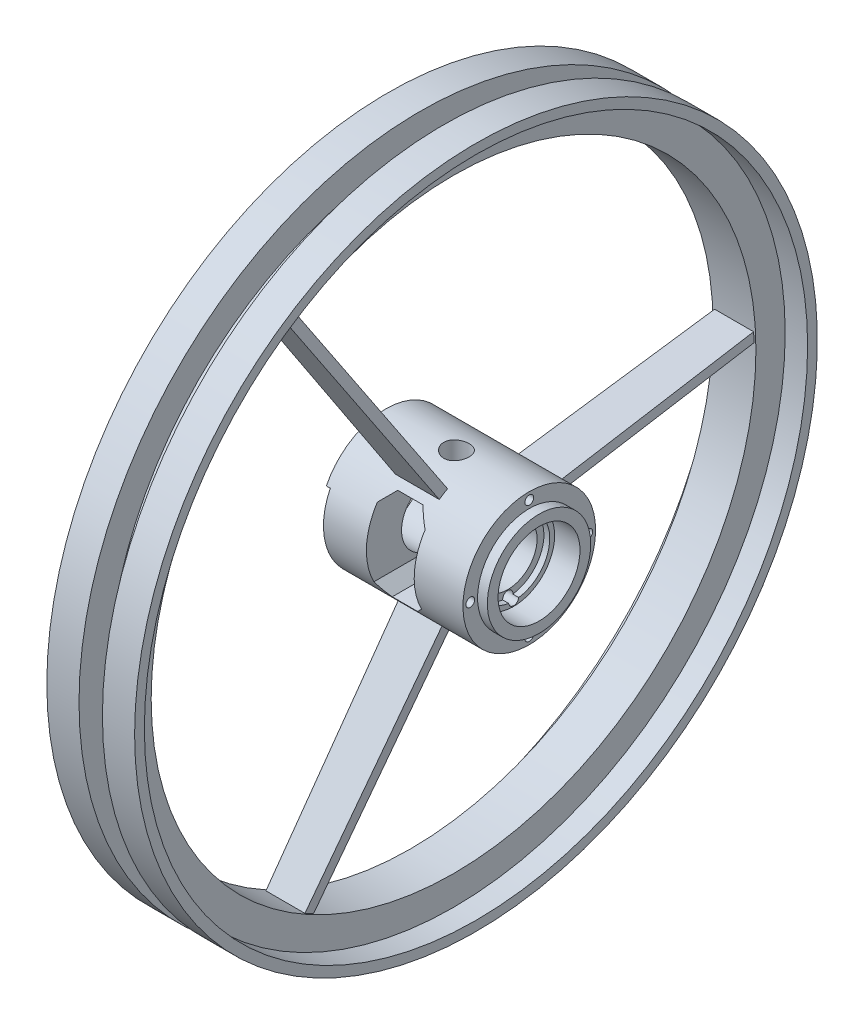
from build123d import *

# Parameters (mm, degrees)
SKETCH1_R                          = 68
BOSS_EXTRUDE1_DEPTH                = 157
CUT_EXTRUDE1_REACH                 = 186.111
SKETCH2_R                          = 26
SKETCH3_W                          = 136
SKETCH3_H                          = 98
CUT_EXTRUDE2_DEPTH                 = 4
CUT_EXTRUDE3_DEPTH                 = 44
SKETCH7_R                          = 42
CUT_EXTRUDE4_DEPTH                 = 26
SKETCH8_R                          = 37
CUT_EXTRUDE5_DEPTH                 = 6
SKETCH9_R                          = 30
CUT_EXTRUDE6_DEPTH                 = 30
CUT_EXTRUDE8_DEPTH                 = 71
TAP_DRILL_FOR_M1_2X0_25_TAP1_D     = 26
TAP_DRILL_FOR_M1_2X0_25_TAP1_DEPTH = 68
CUT_EXTRUDE9_START                 = -10
SKETCH27_R                         = 68
SKETCH27_R_2                       = 53
CUT_EXTRUDE9_DEPTH                 = 10
M8_CLEARANCE_HOLE1_D               = 9
M8_CLEARANCE_HOLE1_DEPTH           = 35
M8_CLEARANCE_HOLE1_TIP             = 2.703872786
BOSS_EXTRUDE4_DEPTH                = 5
CIRPATTERN4_COUNT                  = 3
M10_CLEARANCE_HOLE1_D              = 10.5
M10_CLEARANCE_HOLE1_DEPTH          = 15


with BuildPart() as part:
    # Sketch1 → Boss-Extrude1 (new body)
    with BuildSketch(Plane(origin=(0, 0, 0), x_dir=(0, 0, -1), z_dir=(1, 0, 0))):
        Circle(SKETCH1_R)
    extrude(amount=BOSS_EXTRUDE1_DEPTH)

    # Sketch2 → Cut-Extrude1 (cut, up to next)
    with BuildSketch(Plane.ZY, mode=Mode.PRIVATE) as cut_extrude1_sk1:
        Circle(SKETCH2_R)
    cut_extrude1_tool1 = extrude(cut_extrude1_sk1.sketch, amount=-CUT_EXTRUDE1_REACH, mode=Mode.PRIVATE) & part.part
    add(cut_extrude1_tool1.solids().sort_by_distance((0, 0, 0))[0], mode=Mode.SUBTRACT)

    # Sketch3 → Cut-Extrude2 (cut)
    with BuildSketch(Plane.ZY):
        with Locations((0, -19)):
            Rectangle(SKETCH3_W, SKETCH3_H)
    extrude(amount=-CUT_EXTRUDE2_DEPTH, mode=Mode.SUBTRACT)

    # Sketch4 → Cut-Extrude3 (cut)
    with BuildSketch(Plane.ZY.offset(-4)):
        with BuildLine():
            Line((-13.5, 29), (13.5, 29))
            ThreePointArc((13.5, 29), (0, -31.988279103), (-13.5, 29))
        make_face()
    extrude(amount=-CUT_EXTRUDE3_DEPTH, mode=Mode.SUBTRACT)

    # Sketch7 → Cut-Extrude4 (cut)
    with BuildSketch(Plane(origin=(157, 0, 0), x_dir=(0, 0, -1), z_dir=(1, 0, 0))):
        Circle(SKETCH7_R)
    extrude(amount=-CUT_EXTRUDE4_DEPTH, mode=Mode.SUBTRACT)

    # Sketch8 → Cut-Extrude5 (cut)
    with BuildSketch(Plane(origin=(131, 0, 0), x_dir=(0, 0, -1), z_dir=(1, 0, 0))):
        Circle(SKETCH8_R)
    extrude(amount=-CUT_EXTRUDE5_DEPTH, mode=Mode.SUBTRACT)

    # Sketch9 → Cut-Extrude6 (cut)
    with BuildSketch(Plane(origin=(125, 0, 0), x_dir=(0, 0, -1), z_dir=(1, 0, 0))):
        Circle(SKETCH9_R)
    extrude(amount=-CUT_EXTRUDE6_DEPTH, mode=Mode.SUBTRACT)

    # Sketch12 → Cut-Extrude8 (cut)
    with BuildSketch(Plane.XY.offset(68)):
        Polygon((48, 37.575966949), (48, -31.421583167), (59.373949205, -42.795532372), (85.373949205, -42.795532372), (97, -31.169481577), (97, 37.32386536), (85.373949205, 48.949916154), (59.373949205, 48.949916154), align=None)
    extrude(amount=-CUT_EXTRUDE8_DEPTH, mode=Mode.SUBTRACT)

    # Tap Drill for M1.2x0.25 Tap1
    with Locations(Plane(origin=(0, 68, 0), x_dir=(1, 0, 0), z_dir=(0, 1, 0))):
        with Locations((72.373949205, 0)):
            Hole(TAP_DRILL_FOR_M1_2X0_25_TAP1_D / 2, depth=TAP_DRILL_FOR_M1_2X0_25_TAP1_DEPTH)

    # Sketch27 → Cut-Extrude9 (cut)
    with BuildSketch(Plane(origin=(157, 0, 0), x_dir=(0, 0, -1), z_dir=(1, 0, 0)).offset(CUT_EXTRUDE9_START)):
        Circle(SKETCH27_R)
        Circle(SKETCH27_R_2, mode=Mode.SUBTRACT)
    extrude(amount=CUT_EXTRUDE9_DEPTH, mode=Mode.SUBTRACT)

    # M8 Clearance Hole1
    with Locations(Plane(origin=(147, 0, 0), x_dir=(0, 0, -1), z_dir=(1, 0, 0))):
        with Locations((-60.5, 0), (0, 60.5), (60.5, 0), (0, -60.5)):
            Hole(M8_CLEARANCE_HOLE1_D / 2, depth=M8_CLEARANCE_HOLE1_DEPTH)
            with Locations((0, 0, -(M8_CLEARANCE_HOLE1_DEPTH + M8_CLEARANCE_HOLE1_TIP / 2))):  # 118° drill point
                Cone(0, M8_CLEARANCE_HOLE1_D / 2, M8_CLEARANCE_HOLE1_TIP, mode=Mode.SUBTRACT)



with BuildPart() as body_2:
    # Sketch21 → Revolve1 (revolve)
    with BuildSketch(Plane(origin=(0, 0, 0), x_dir=(-1, 0, 0), z_dir=(0, 0.528534662230602, -0.8489117214532872))):
        Polygon((-67.368890821, 310), (-69.368890821, 310), (-69.368890821, 340), (-92.368890821, 340), (-92.368890821, 350), (-59.368890821, 350), (-59.368890821, 320), (-35.368890821, 320), (-35.368890821, 350), (-2.368890821, 350), (-2.368890821, 340), (-25.368890821, 340), (-25.368890821, 310), (-27.368890821, 310), align=None)
    revolve(axis=Axis((0, 0, 0), (1, 0, 0)))


with BuildPart() as part_1:
    add(part.part)

    add(body_2.part)  # Boss-Extrude4 merges body 2
    # Sketch19 → Boss-Extrude4 (add, symmetric)
    with BuildSketch(Plane(origin=(0, 0, 0), x_dir=(-1, 0, 0), z_dir=(0, 0.528534662230602, -0.8489117214532872))):
        Polygon((-27.368890821, 310), (-67.368890821, 310), (-95, 66.5), (-50, 66.5), align=None)
    boss_extrude4 = extrude(amount=BOSS_EXTRUDE4_DEPTH, both=True)

    # CirPattern4: Boss-Extrude4 ×3 about axis
    cirpattern4_axis = Axis((0, 0, 0), (1, 0, 0))
    for i in range(1, CIRPATTERN4_COUNT):
        add(boss_extrude4.rotate(cirpattern4_axis, i * 360 / CIRPATTERN4_COUNT))

    # M10 Clearance Hole1
    with Locations(Plane(origin=(131, 0, 0), x_dir=(0, 0, -1), z_dir=(1, 0, 0))):
        with Locations((0, -36)):
            Hole(M10_CLEARANCE_HOLE1_D / 2, depth=M10_CLEARANCE_HOLE1_DEPTH)


solid = part_1.part
